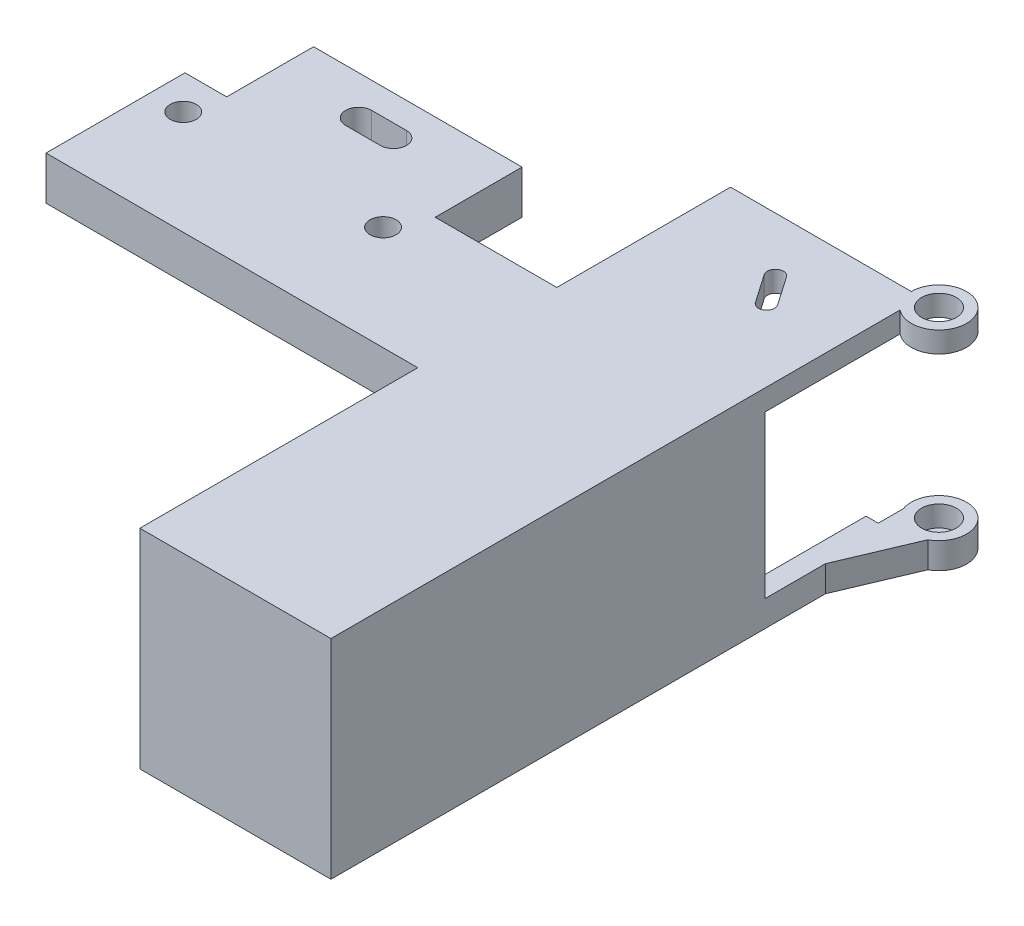
from build123d import *

# Parameters (mm, degrees)
BOSS_EXTRUDE1_DEPTH  = 12.5
BOSS_EXTRUDE2_DEPTH  = 60
SKETCH3_W            = 50
SKETCH3_H            = 55
CUT_EXTRUDE1_DEPTH   = 167.5
FILLET1_SIZE         = 2.5
FILLET1_SIZE_2       = 10
BOSS_EXTRUDE3_REACH  = 196.792
SKETCH6_R            = 7.951814216
CUT_EXTRUDE2_DEPTH   = 55
SKETCH9_W            = 5.049792513
SKETCH9_H            = 55
CUT_EXTRUDE3_DEPTH   = 2.5
SKETCH10_R           = 5
CUT_EXTRUDE4_DEPTH   = 58.5
SKETCH11_W           = 20
SKETCH11_H           = 55
CUT_EXTRUDE6_DEPTH   = 2.5
SKETCH12_W           = 49.615365164
SKETCH12_H           = 4.469133196
CUT_EXTRUDE7_DEPTH   = 167.5
BOSS_EXTRUDE4_START  = 5
SKETCH13_R           = 5
BOSS_EXTRUDE4_DEPTH  = 5
BOSS_EXTRUDE5_DEPTH  = 2.5
SKETCH17_W           = 167.5
SKETCH17_H           = 57.5
BOSS_EXTRUDE6_DEPTH  = 3.5
BOSS_EXTRUDE7_DEPTH  = 3.5
SKETCH20_W           = 139.813438208
SKETCH20_H           = 51.5
BOSS_EXTRUDE8_DEPTH  = 3.5
BOSS_EXTRUDE9_DEPTH  = 3.115365164
BOSS_EXTRUDE10_START = 4
BOSS_EXTRUDE10_DEPTH = 4
SKETCH24_R           = 3.75
CUT_EXTRUDE8_DEPTH   = 210.262529948
CUT_EXTRUDE9_DEPTH   = 210.262529948
SKETCH26_R           = 5
CUT_EXTRUDE10_DEPTH  = 3.5
BOSS_EXTRUDE11_DEPTH = 40
FILLET2_R            = 10
CUT_EXTRUDE11_DEPTH  = 6
SKETCH30_W           = 17.446895317
SKETCH30_H           = 47.5
CUT_EXTRUDE12_DEPTH  = 15
BOSS_EXTRUDE12_START = 1
BOSS_EXTRUDE12_DEPTH = 1


with BuildPart() as part:
    # Sketch1 → Boss-Extrude1 (new body)
    with BuildSketch(Plane(origin=(0, 0, 0), x_dir=(1, 0, 0), z_dir=(0, 1, 0))):
        Polygon((0, 0), (0, 40), (12, 40), (12, 65), (72, 65), (72, 40), (107, 40), (107, 0), align=None)
    extrude(amount=BOSS_EXTRUDE1_DEPTH)

    # Sketch2 → Boss-Extrude2 (add)
    with BuildSketch(Plane(origin=(0, 12.5, 0), x_dir=(1, 0, 0), z_dir=(0, 1, 0))):
        Polygon((107, 0), (107, 40), (107, 90), (162, 90), (162, -80), (107, -80), align=None)
    extrude(amount=-BOSS_EXTRUDE2_DEPTH)

    # Sketch3 → Cut-Extrude1 (cut)
    with BuildSketch(Plane(origin=(0, 0, -90), x_dir=(-1, 0, 0), z_dir=(0, 0, -1))):
        with Locations((-134.5, -17.5)):
            Rectangle(SKETCH3_W, SKETCH3_H)
    extrude(amount=-CUT_EXTRUDE1_DEPTH, mode=Mode.SUBTRACT)

    # Fillet1
    # an asymmetric fillet: 10, 2.5 mm, written as the material it takes off along each edge
    with BuildSketch(Plane(origin=(159.5, -45, -90), x_dir=(0, -1, 0), z_dir=(-1, 0, 0))) as fillet1_piece_1:
        with BuildLine():
            Bezier((FILLET1_SIZE, 0), (0, 0), (0, FILLET1_SIZE_2), weights=[1, 0.707106781, 1])
            Line((0, FILLET1_SIZE_2), (0, 0))
            Line((0, 0), (FILLET1_SIZE, 0))
        make_face()
    extrude(amount=50, mode=Mode.SUBTRACT)

    # Boss-Extrude3: up to this face of the body (flat: up to its plane)
    boss_extrude3_end = Plane(part.part.faces().sort_by_distance((134.5, -47.5, -5))[0])
    # Sketch6 → Boss-Extrude3 (add, up to the picked face)
    with BuildSketch(Plane(origin=(0, 12.5, 0), x_dir=(1, 0, 0), z_dir=(0, 1, 0)), mode=Mode.PRIVATE) as boss_extrude3_sk1:
        with Locations((166.966019237, 90)):
            Circle(SKETCH6_R)
    boss_extrude3_tool1 = split(extrude(boss_extrude3_sk1.sketch, amount=-BOSS_EXTRUDE3_REACH, mode=Mode.PRIVATE), bisect_by=boss_extrude3_end, keep=Keep.BOTH, mode=Mode.PRIVATE)
    add(boss_extrude3_tool1.solids().sort_by(Axis((166.966019, 12.5, -90), (0, -1, 0)))[0])

    # Sketch7 → Cut-Extrude2 (cut)
    with BuildSketch(Plane(origin=(0, 10, 0), x_dir=(1, 0, 0), z_dir=(0, 1, 0))):
        with BuildLine():
            ThreePointArc((162, 83.789524795), (174.132615768, 93.445467092), (159.01420502, 90))
            ThreePointArc((159.01420502, 90), (159.799422705, 86.554532908), (162, 83.789524795))
        make_face()
    extrude(amount=-CUT_EXTRUDE2_DEPTH, mode=Mode.SUBTRACT)

    # Sketch9 → Cut-Extrude3 (cut)
    with BuildSketch(Plane(origin=(162, 0, 0), x_dir=(0, 0, -1), z_dir=(1, 0, 0))):
        with Locations((84.738334464, -17.5)):
            Rectangle(SKETCH9_W, SKETCH9_H)
    extrude(amount=-CUT_EXTRUDE3_DEPTH, mode=Mode.SUBTRACT)

    # Sketch10 → Cut-Extrude4 (cut)
    with BuildSketch(Plane(origin=(0, 12.5, 0), x_dir=(1, 0, 0), z_dir=(0, 1, 0))):
        with Locations(Location((166.966019237, 90, 0), (0, 0, 270))):
            Circle(SKETCH10_R)
    extrude(amount=-CUT_EXTRUDE4_DEPTH, mode=Mode.SUBTRACT)

    # Sketch11 → Cut-Extrude6 (cut)
    with BuildSketch(Plane(origin=(162, 0, 0), x_dir=(0, 0, -1), z_dir=(1, 0, 0))):
        with Locations((72.313438208, -17.5)):
            Rectangle(SKETCH11_W, SKETCH11_H)
    extrude(amount=-CUT_EXTRUDE6_DEPTH, mode=Mode.SUBTRACT)

    # Sketch12 → Cut-Extrude7 (cut)
    with BuildSketch(Plane(origin=(0, 0, -90), x_dir=(-1, 0, 0), z_dir=(0, 0, -1))):
        with Locations((-134.307682582, -47.234566598)):
            Rectangle(SKETCH12_W, SKETCH12_H)
    extrude(amount=-CUT_EXTRUDE7_DEPTH, mode=Mode.SUBTRACT)

    # Sketch13 → Boss-Extrude4 (add)
    with BuildSketch(Plane(origin=(0, -45, 0), x_dir=(1, 0, 0), z_dir=(0, 1, 0)).offset(BOSS_EXTRUDE4_START)):
        with BuildLine():
            ThreePointArc((162, 83.789524795), (174.132615768, 93.445467092), (159.01420502, 90))
            ThreePointArc((159.01420502, 90), (159.799422705, 86.554532908), (162, 83.789524795))
        make_face()
        with Locations(Location((166.966019237, 90, 0), (0, 0, 270))):
            Circle(SKETCH13_R, mode=Mode.SUBTRACT)
    extrude(amount=-BOSS_EXTRUDE4_DEPTH)

    # Sketch15 → Boss-Extrude5 (add)
    with BuildSketch(Plane(origin=(0, -45, 0), x_dir=(1, 0, 0), z_dir=(0, 1, 0))):
        with BuildLine():
            Line((162, 62.313438208), (162, 83.789524795))
            ThreePointArc((162, 83.789524795), (166.263013728, 82.079322467), (170.760595676, 83.011971739))
            Line((170.760595676, 83.011971739), (162, 62.313438208))
        make_face()
    extrude(amount=-BOSS_EXTRUDE5_DEPTH)

    # Sketch17 → Boss-Extrude6 (add)
    with BuildSketch(Plane(origin=(109.5, 0, 0), x_dir=(0, 0, -1), z_dir=(1, 0, 0))):
        with Locations((6.25, -18.75)):
            Rectangle(SKETCH17_W, SKETCH17_H)
    extrude(amount=BOSS_EXTRUDE6_DEPTH)

    # Sketch19 → Boss-Extrude7 (add)
    with BuildSketch(Plane.XZ.offset(-10)):
        with BuildLine():
            Line((159.5, 77.5), (113, 77.5))
            Line((113, 77.5), (113, -90))
            Line((113, -90), (159.01420502, -90))
            ThreePointArc((159.01420502, -90), (174.132615768, -93.445467092), (162, -83.789524795))
            Line((162, -83.789524795), (162, -62.313438208))
            Line((162, -62.313438208), (159.5, -62.313438208))
            Line((159.5, -62.313438208), (159.5, 77.5))
        make_face()
    extrude(amount=BOSS_EXTRUDE7_DEPTH)

    # Sketch20 → Boss-Extrude8 (add)
    with BuildSketch(Plane.ZY.offset(-159.5)):
        with Locations((7.593280896, -19.25)):
            Rectangle(SKETCH20_W, SKETCH20_H)
    extrude(amount=BOSS_EXTRUDE8_DEPTH)

    # Sketch21 → Boss-Extrude9 (add)
    with BuildSketch(Plane.ZY.offset(-159.115365164)):
        with BuildLine():
            Line((-90, -47.5), (77.5, -47.5))
            Line((77.5, -47.5), (77.5, -45))
            Line((77.5, -45), (-62.313438208, -45))
            Line((-62.313438208, -45), (-80, -45))
            add(Edge.make_bspline(
                [(-80, -45), (-85.875836894, -45), (-88.73565038, -46.28323142)],
                knots=[0.331688308, 0.331688308, 0.331688308, 1, 1, 1], degree=2, weights=[1, 0.804256037, 0.870148033]))
            Line((-88.73565038, -46.28323142), (-88.73565038, -45))
            Line((-88.73565038, -45), (-90, -45))
            Line((-90, -45), (-90, -47.5))
        make_face()
    extrude(amount=BOSS_EXTRUDE9_DEPTH)

    # Sketch22 → Boss-Extrude10 (add)
    with BuildSketch(Plane(origin=(0, -45, 0), x_dir=(1, 0, 0), z_dir=(0, 1, 0)).offset(BOSS_EXTRUDE10_START)):
        with BuildLine():
            Line((159.5, 80), (159.115365164, 80))
            Line((159.115365164, 80), (156, 80))
            Line((156, 80), (156, 62.313438208))
            Line((156, 62.313438208), (162, 62.313438208))
            Line((162, 62.313438208), (170.760595676, 83.011971739))
            ThreePointArc((170.760595676, 83.011971739), (164.157429949, 82.560700601), (159.5, 87.263230721))
            Line((159.5, 87.263230721), (159.5, 80))
        make_face()
    extrude(amount=-BOSS_EXTRUDE10_DEPTH)

    # Sketch24 → Cut-Extrude8 (cut, through all)
    with BuildSketch(Plane(origin=(0, 12.5, 0), x_dir=(1, 0, 0), z_dir=(0, 1, 0))):
        with Locations(Location((67, 30, 0), (0, 0, 270))):
            Circle(SKETCH24_R)
        with Locations(Location((9.5, 30, 0), (0, 0, 270))):
            Circle(SKETCH24_R)
    extrude(amount=-CUT_EXTRUDE8_DEPTH, mode=Mode.SUBTRACT)

    # Sketch25 → Cut-Extrude9 (cut, through all)
    with BuildSketch(Plane(origin=(0, 12.5, 0), x_dir=(1, 0, 0), z_dir=(0, 1, 0))):
        with BuildLine():
            Line((36.227939868, 57.5), (46.227939868, 57.5))
            ThreePointArc((46.227939868, 57.5), (49.977939868, 53.75), (46.227939868, 50))
            Line((46.227939868, 50), (36.227939868, 50))
            ThreePointArc((36.227939868, 50), (32.477939868, 53.75), (36.227939868, 57.5))
        make_face()
    extrude(amount=-CUT_EXTRUDE9_DEPTH, mode=Mode.SUBTRACT)

    # Sketch26 → Cut-Extrude10 (cut)
    with BuildSketch(Plane(origin=(0, 10, 0), x_dir=(1, 0, 0), z_dir=(0, 1, 0))):
        with Locations(Location((166.966019237, 90, 0), (0, 0, 270))):
            Circle(SKETCH26_R)
    extrude(amount=-CUT_EXTRUDE10_DEPTH, mode=Mode.SUBTRACT)

    # Sketch27 → Boss-Extrude11 (add)
    with BuildSketch(Plane(origin=(0, 0, -40), x_dir=(-1, 0, 0), z_dir=(0, 0, -1))):
        Polygon((-102.323268395, 0), (-107, -4.676731605), (-107, 0), align=None)
    extrude(amount=-BOSS_EXTRUDE11_DEPTH)

    # Fillet2
    fillet2_edges = [part.edges().sort_by_distance(p)[0] for p in [
        (113, 6.5, -6.25),
        (156, 6.5, 7.593280896),
    ]]
    fillet(fillet2_edges, radius=FILLET2_R)

    # Sketch28 → Cut-Extrude11 (cut)
    with BuildSketch(Plane(origin=(0, 12.5, 0), x_dir=(1, 0, 0), z_dir=(0, 1, 0))):
        with BuildLine():
            Line((137.427240594, 75.66601743), (143.112121915, 67.439102797))
            ThreePointArc((143.112121915, 67.439102797), (142.527454254, 64.239389728), (139.327741185, 64.82405739))
            Line((139.327741185, 64.82405739), (133.642859864, 73.050972022))
            ThreePointArc((133.642859864, 73.050972022), (134.227527525, 76.250685091), (137.427240594, 75.66601743))
        make_face()
    extrude(amount=-CUT_EXTRUDE11_DEPTH, mode=Mode.SUBTRACT)

    # Sketch30 → Cut-Extrude12 (cut)
    with BuildSketch(Plane(origin=(162, 0, 0), x_dir=(0, 0, -1), z_dir=(1, 0, 0))):
        with Locations((53.58999055, -17.25)):
            Rectangle(SKETCH30_W, SKETCH30_H)
    extrude(amount=-CUT_EXTRUDE12_DEPTH, mode=Mode.SUBTRACT)

    # Sketch31 → Boss-Extrude12 (add)
    with BuildSketch(Plane(origin=(0, -41, 0), x_dir=(1, 0, 0), z_dir=(0, 1, 0)).offset(BOSS_EXTRUDE12_START)):
        with BuildLine():
            Line((159.5, 87.263230721), (159.5, 80))
            Line((159.5, 80), (156, 80))
            Line((156, 80), (156, 44.866542891))
            Line((156, 44.866542891), (162, 44.866542891))
            Line((162, 44.866542891), (162, 62.313438208))
            Line((162, 62.313438208), (170.760595676, 83.011971739))
            ThreePointArc((170.760595676, 83.011971739), (164.157429949, 82.560700601), (159.5, 87.263230721))
        make_face()
    extrude(amount=-BOSS_EXTRUDE12_DEPTH)


solid = part.part
